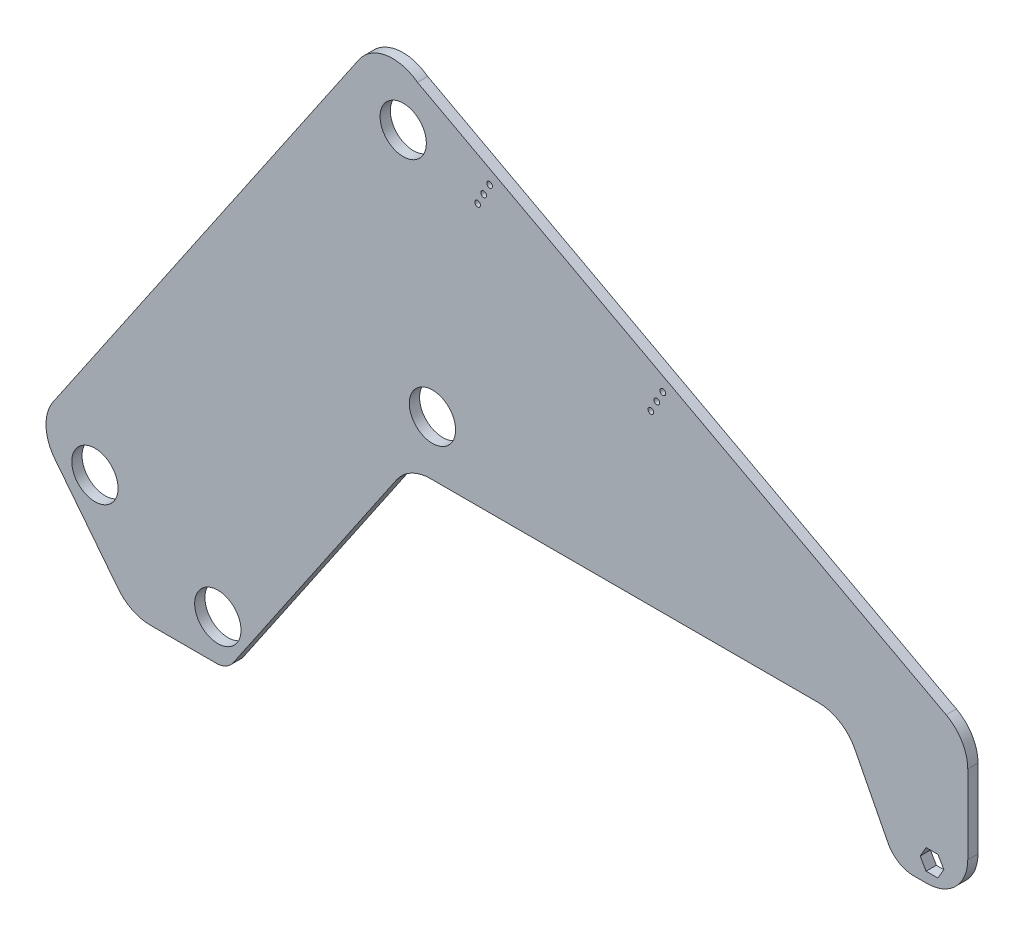
from build123d import *

# Parameters (mm, degrees)
MODEL_R             = 14.351
MODEL_R_2           = 1.778
BOSS_EXTRUDE1_DEPTH = 6.35


with BuildPart() as part:
    # Model → Boss-Extrude1 (new body)
    with BuildSketch(Plane.XY):
        with BuildLine():
            ThreePointArc((-212.899365952, 93.541257838), (-203.778989185, 101.701881024), (-191.901103209, 104.650248016))
            Line((-191.901103209, 104.650248016), (48.661197018, 104.650248016))
            ThreePointArc((48.661197018, 104.650248016), (61.901986038, 100.926075708), (71.260020742, 90.8456422))
            Line((71.260020742, 90.8456422), (91.800416921, 50.813472087))
            ThreePointArc((91.800416921, 50.813472087), (98.351041214, 43.757168632), (107.619593528, 41.150248016))
            Line((107.619593528, 41.150248016), (115.808590566, 41.150248016))
            ThreePointArc((115.808590566, 41.150248016), (133.769102808, 48.589735774), (141.208590566, 66.550248016))
            Line((141.208590566, 66.550248016), (141.208590566, 115.30333804))
            ThreePointArc((141.208590566, 115.30333804), (137.602779127, 128.348388632), (127.809114585, 137.689660276))
            Line((127.809114585, 137.689660276), (-199.949582693, 313.389629113))
            ThreePointArc((-199.949582693, 313.389629113), (-219.402189514, 318.224062751), (-236.303247901, 307.447705012))
            Line((-236.303247901, 307.447705012), (-425.920878295, 28.83612519))
            ThreePointArc((-425.920878295, 28.83612519), (-430.307847502, 13.679090678), (-424.898106806, -1.143726181))
            Line((-424.898106806, -1.143726181), (-385.58146606, -51.20282143))
            ThreePointArc((-385.58146606, -51.20282143), (-376.71145599, -58.357541068), (-365.605974805, -60.913979882))
            Line((-365.605974805, -60.913979882), (-324.737451002, -60.913979882))
            ThreePointArc((-324.737451002, -60.913979882), (-318.798508014, -59.439796386), (-314.23831963, -55.359484793))
            Line((-314.23831963, -55.359484793), (-212.899365952, 93.541257838))
        make_face()
        with Locations((-323.775189267, -35.513979882)):
            Circle(MODEL_R, mode=Mode.SUBTRACT)
        with Locations((-399.975189267, 2.586020118)):
            Circle(MODEL_R, mode=Mode.SUBTRACT)
        Polygon((122.716975548, 60.200248016), (126.383149757, 53.850248016), (122.716975548, 47.500248016), (115.384627129, 47.500248016), (111.71845292, 53.850248016), (115.384627129, 60.200248016), align=None, mode=Mode.SUBTRACT)
        with Locations((-190.707148919, 138.516914683)):
            Circle(MODEL_R, mode=Mode.SUBTRACT)
        with Locations((-55.266359723, 209.316183378)):
            Circle(MODEL_R_2, mode=Mode.SUBTRACT)
        with Locations((-51.546197277, 216.255943271)):
            Circle(MODEL_R_2, mode=Mode.SUBTRACT)
        with Locations((-47.826034831, 223.195703164)):
            Circle(MODEL_R_2, mode=Mode.SUBTRACT)
        with Locations((-162.68538176, 266.899762337)):
            Circle(MODEL_R_2, mode=Mode.SUBTRACT)
        with Locations((-208.832932893, 283.437784316)):
            Circle(MODEL_R, mode=Mode.SUBTRACT)
        with Locations((-158.965219314, 273.83952223)):
            Circle(MODEL_R_2, mode=Mode.SUBTRACT)
        with Locations((-155.245056868, 280.779282123)):
            Circle(MODEL_R_2, mode=Mode.SUBTRACT)
    extrude(amount=BOSS_EXTRUDE1_DEPTH)


solid = part.part
